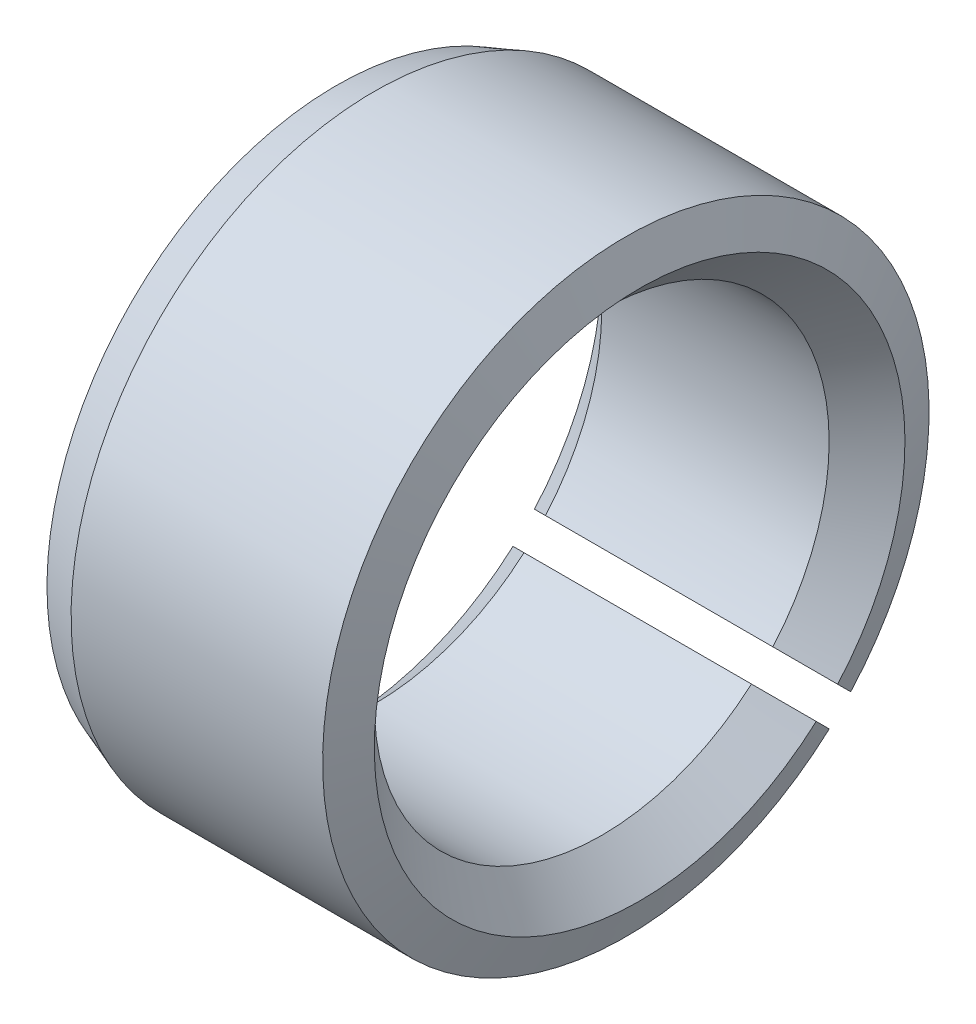
from build123d import *
from OCP.BRepFilletAPI import BRepFilletAPI_MakeChamfer

# Parameters (mm, degrees)
ESQUISSE1_W             = 4
ESQUISSE1_H             = 4
ENL_V_MAT_EXTRU_1_DEPTH = 7.92820323
ESQUISSE3_W             = 4
ESQUISSE3_H             = 3
CHANFREIN1_SIZE         = 0.5
CHANFREIN2_SIZE         = 0.5
CHANFREIN2_SIZE_2       = 0.181985117


with BuildPart() as part:
    # Esquisse1 → Révolution1 (revolve)
    with BuildSketch(Plane.XY, mode=Mode.PRIVATE) as r_volution1_sk:
        with Locations((2, 2)):
            Rectangle(ESQUISSE1_W, ESQUISSE1_H)
    revolve(r_volution1_sk.sketch.rotate(Axis((0, 0, 0), (1, 0, 0)), 270), axis=Axis((0, 0, 0), (1, 0, 0)))

    # Esquisse2 → Enlèv. mat.-Extru.1 (cut, through all)
    with BuildSketch(Plane(origin=(4, 0, 0), x_dir=(0, 0, -1), z_dir=(1, 0, 0))):
        with BuildLine():
            Line((2.966310735, -2.683468022), (2.258022405, -1.975179693))
            ThreePointArc((2.258022405, -1.975179693), (2.121320344, -2.121320344), (1.975179693, -2.258022405))
            Line((1.975179693, -2.258022405), (2.683468022, -2.966310735))
            ThreePointArc((2.683468022, -2.966310735), (2.828427125, -2.828427125), (2.966310735, -2.683468022))
        make_face()
    extrude(amount=-ENL_V_MAT_EXTRU_1_DEPTH, mode=Mode.SUBTRACT)

    # Esquisse3 → Enlèvement de matière-Révolution1 (revolve, cut)
    with BuildSketch(Plane(origin=(0, 0, 0), x_dir=(-1, 0, 0), z_dir=(0, 0, -1))):
        with Locations((-2, 1.5)):
            Rectangle(ESQUISSE3_W, ESQUISSE3_H)
    revolve(axis=Axis((4, 0, 0), (-1, 0, 0)), mode=Mode.SUBTRACT)

    # Chanfrein1
    chanfrein1_edges = [part.edges().sort_by_distance(p)[0] for p in [
        (4, -1.054972224, 2.8083863),
        (0, -1.054972224, 2.8083863),
    ]]
    chamfer(chanfrein1_edges, length=CHANFREIN1_SIZE)

    # Chanfrein2
    chanfrein2_edges_1 = [part.edges().sort_by_distance(p)[0] for p in [
        (4, 2.828427125, 2.828427125),
    ]]
    chanfrein2_side_1 = [part.faces().sort_by_distance(p)[0] for p in [
        (4, 2.825853467, 2.825853467),
    ]]
    chanfrein2_edges_2 = [part.edges().sort_by_distance(p)[0] for p in [
        (0, 2.828427125, 2.828427125),
    ]]
    chanfrein2_side_2 = [part.faces().sort_by_distance(p)[0] for p in [
        (0, 2.825853467, 2.825853467),
    ]]
    chanfrein2 = BRepFilletAPI_MakeChamfer(part.part.solid().wrapped)
    for e in chanfrein2_edges_1:
        chanfrein2.Add(CHANFREIN2_SIZE - 0.0001, CHANFREIN2_SIZE_2 - 0.0001, e.wrapped, chanfrein2_side_1[0].wrapped)
    for e in chanfrein2_edges_2:
        chanfrein2.Add(CHANFREIN2_SIZE_2 - 0.0001, CHANFREIN2_SIZE - 0.0001, e.wrapped, chanfrein2_side_2[0].wrapped)
    add(Compound.cast(chanfrein2.Shape()), mode=Mode.REPLACE)  # a hair under: the kernel refuses the full size


solid = part.part
